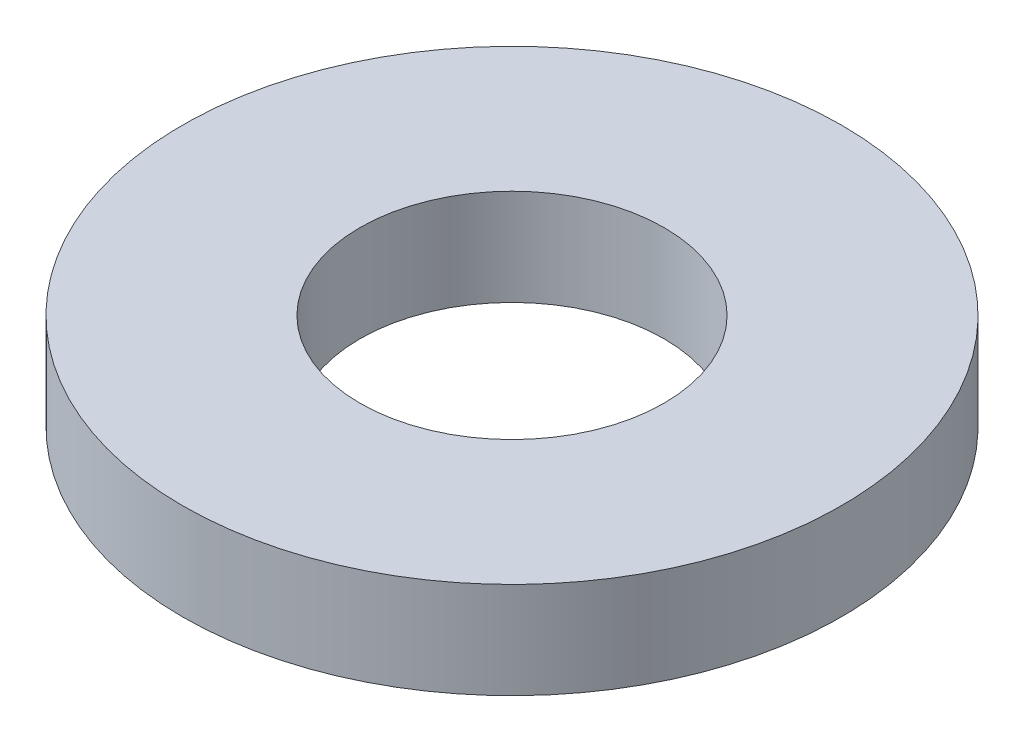
from build123d import *

# Parameters (mm, degrees)
SKETCH1_R           = 65
BOSS_EXTRUDE1_DEPTH = 19
SKETCH2_R           = 30
CUT_EXTRUDE1_DEPTH  = 94.866927083


with BuildPart() as part:
    # Sketch1 → Boss-Extrude1 (new body)
    with BuildSketch(Plane(origin=(0, 0, 0), x_dir=(1, 0, 0), z_dir=(0, 1, 0))):
        Circle(SKETCH1_R)
    extrude(amount=BOSS_EXTRUDE1_DEPTH)

    # Sketch2 → Cut-Extrude1 (cut, through all)
    with BuildSketch(Plane(origin=(0, 0, 0), x_dir=(1, 0, 0), z_dir=(0, 1, 0))):
        Circle(SKETCH2_R)
    extrude(amount=CUT_EXTRUDE1_DEPTH, mode=Mode.SUBTRACT)


solid = part.part
